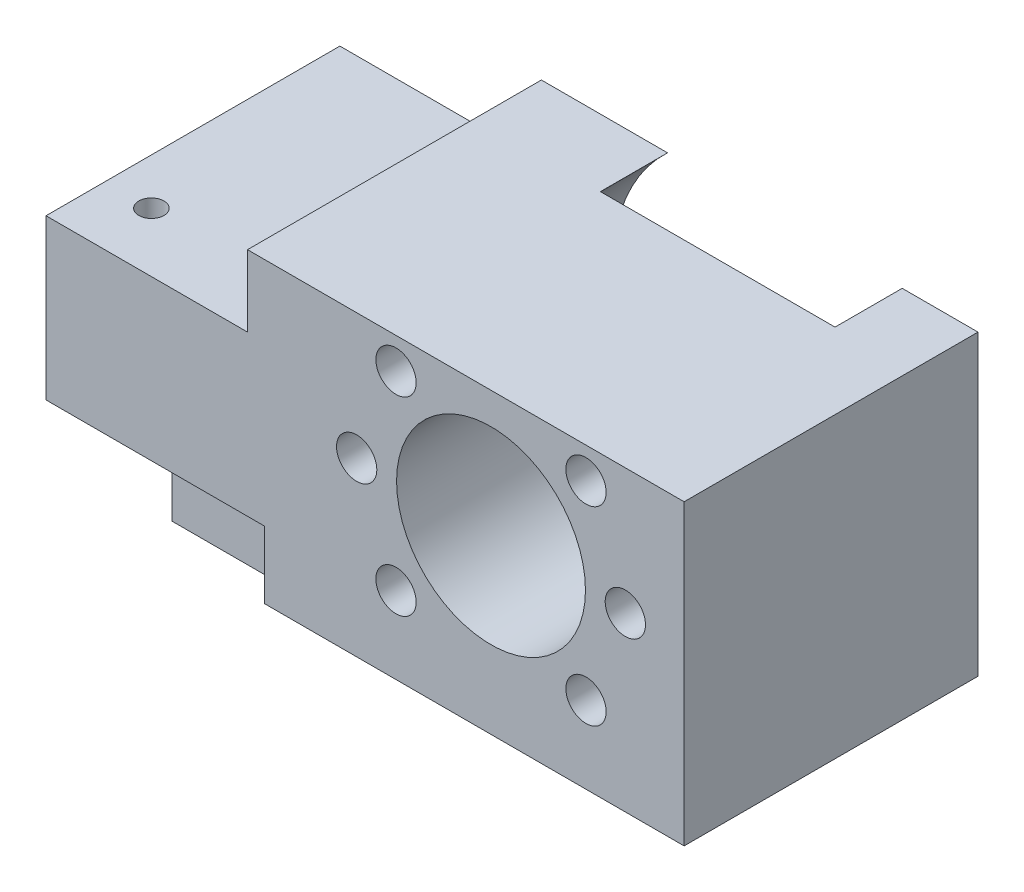
from build123d import *

# Parameters (mm, degrees)
SKETCH_1_W           = 70
SKETCH_1_H           = 30
EXTRUDE_1_DEPTH      = 27
CUT_EXTRUDE_1_DEPTH  = 47.679760068
SKETCH_3_R           = 2.4
CUT_EXTRUDE_2_DEPTH  = 47.679760068
SKETCH_4_W           = 21
SKETCH_4_H           = 8.5
CUT_EXTRUDE_3_DEPTH  = 47.679760068
SKETCH_7_R           = 11.25
CUT_EXTRUDE_5_DEPTH  = 47.679760068
SKETCH_8_W           = 21.5
SKETCH_8_H           = 21.5
EXTRUDE_2_DEPTH      = 8
SKETCH_10_R          = 1.5
CUT_EXTRUDE_6_DEPTH  = 54.422841557
SKETCH_12_W          = 35
SKETCH_12_H          = 21.5
EXTRUDE_3_DEPTH      = 3
SKETCH_13_R          = 3
CUT_EXTRUDE_7_DEPTH  = 15
SKETCH_14_R          = 2.4
EXTRUDE_4_DEPTH      = 27
SKETCH_15_W          = 27
SKETCH_15_H          = 30
EXTRUDE_5_DEPTH      = 3
EXTRUDE_START        = 5.5
SKETCH_16_R          = 3
EXTRUDE_6_DEPTH      = 5.5
SKETCH_22_W          = 26
SKETCH_22_H          = 15
CUT_EXTRUDE_9_DEPTH  = 8
EXTRUDE_START_2      = 8
SKETCH_20_R          = 11.25
EXTRUDE_8_DEPTH      = 8
CUT_EXTRUDE_8_DEPTH  = 8
SKETCH_23_W          = 26
SKETCH_23_H          = 20
EXTRUDE_9_DEPTH      = 17
SKETCH_24_R          = 2
CUT_EXTRUDE_10_DEPTH = 64.837684795
SKETCH_25_R          = 3.75
CUT_EXTRUDE_11_DEPTH = 5
SKETCH_26_R          = 3.1
CUT_EXTRUDE_12_DEPTH = 16
SKETCH_27_R          = 1.25
CUT_EXTRUDE_13_DEPTH = 10
SKETCH_28_W          = 2
SKETCH_28_H          = 12.06571985
CUT_EXTRUDE_14_DEPTH = 16
FILLET_1_R           = 2
SKETCH_29_W          = 20
SKETCH_29_H          = 5
CUT_EXTRUDE_15_DEPTH = 89.945207853


with BuildPart() as part:
    # 草图1 → 凸台-拉伸1 (new body)
    with BuildSketch(Plane.XY):
        Rectangle(SKETCH_1_W, SKETCH_1_H)
    extrude(amount=EXTRUDE_1_DEPTH)

    # 草图2 → 切除-拉伸1 (cut, through all)
    with BuildSketch(Plane.XY.offset(27)):
        with BuildLine():
            Line((28.228756555, -15), (35, -15))
            Line((35, -15), (35, 0))
            ThreePointArc((35, 0), (33.228756555, -8.228756555), (28.228756555, -15))
        make_face()
        with BuildLine():
            ThreePointArc((28.228756555, 15), (33.228756555, 8.228756555), (35, 0))
            Line((35, 0), (35, 15))
            Line((35, 15), (28.228756555, 15))
        make_face()
    extrude(amount=-CUT_EXTRUDE_1_DEPTH, mode=Mode.SUBTRACT)

    # 草图3 → 切除-拉伸2 (cut, through all)
    with BuildSketch(Plane.XY.offset(27)):
        with Locations((31, 0)):
            Circle(SKETCH_3_R)
        with Locations((26.313708499, 11.313708499)):
            Circle(SKETCH_3_R)
        with Locations((26.313708499, -11.313708499)):
            Circle(SKETCH_3_R)
        with Locations((3.686291501, 11.313708499)):
            Circle(SKETCH_3_R)
        with Locations((3.686291501, -11.313708499)):
            Circle(SKETCH_3_R)
        with Locations((-1, 0)):
            Circle(SKETCH_3_R)
    extrude(amount=-CUT_EXTRUDE_2_DEPTH, mode=Mode.SUBTRACT)

    # 草图4 → 切除-拉伸3 (cut, through all)
    with BuildSketch(Plane.XY.offset(27)):
        with Locations((-24.5, 10.75)):
            Rectangle(SKETCH_4_W, SKETCH_4_H)
    extrude(amount=-CUT_EXTRUDE_3_DEPTH, mode=Mode.SUBTRACT)

    # 草图7 → 切除-拉伸5 (cut, through all)
    with BuildSketch(Plane(origin=(0, 0, 0), x_dir=(-1, 0, 0), z_dir=(0, 0, -1))):
        with Locations((-15, 0)):
            Circle(SKETCH_7_R)
    extrude(amount=-CUT_EXTRUDE_5_DEPTH, mode=Mode.SUBTRACT)

    # 草图8 → 凸台-拉伸2 (add)
    with BuildSketch(Plane(origin=(0, 0, 0), x_dir=(-1, 0, 0), z_dir=(0, 0, -1))):
        with Locations((24.25, -4.25)):
            Rectangle(SKETCH_8_W, SKETCH_8_H)
    extrude(amount=EXTRUDE_2_DEPTH)

    # 草图10 → 切除-拉伸6 (cut, through all)
    with BuildSketch(Plane.XZ.offset(15)):
        with Locations((-17.5, 19.95)):
            Circle(SKETCH_10_R)
        with Locations((-32.5, 19.95)):
            Circle(SKETCH_10_R)
    extrude(amount=-CUT_EXTRUDE_6_DEPTH, mode=Mode.SUBTRACT)

    # 草图12 → 凸台-拉伸3 (add)
    with BuildSketch(Plane.ZY.offset(35)):
        with Locations((9.5, -4.25)):
            Rectangle(SKETCH_12_W, SKETCH_12_H)
    extrude(amount=EXTRUDE_3_DEPTH)

    # 草图13 → 切除-拉伸7 (cut)
    with BuildSketch(Plane.XZ.offset(15)):
        with Locations((-32.5, 19.95)):
            Circle(SKETCH_13_R)
        with Locations((-17.5, 19.95)):
            Circle(SKETCH_13_R)
    extrude(amount=-CUT_EXTRUDE_7_DEPTH, mode=Mode.SUBTRACT)

    # 草图14 → 凸台-拉伸4 (add)
    with BuildSketch(Plane.XY.offset(27)):
        with BuildLine():
            Line((28.228756555, -15), (35, -15))
            Line((35, -15), (35, 0))
            Line((35, 0), (35, 15))
            Line((35, 15), (28.228756555, 15))
            Line((28.228756555, 15), (28.228756555, 12.760287547))
            ThreePointArc((28.228756555, 12.760287547), (28.713708499, 11.313708499), (28.228756555, 9.867129451))
            Line((28.228756555, 9.867129451), (28.228756555, 0))
            Line((28.228756555, 0), (28.228756555, -9.867129451))
            ThreePointArc((28.228756555, -9.867129451), (28.713708499, -11.313708499), (28.228756555, -12.760287547))
            Line((28.228756555, -12.760287547), (28.228756555, -15))
        make_face()
        with Locations((31, 0)):
            Circle(SKETCH_14_R, mode=Mode.SUBTRACT)
    extrude(amount=-EXTRUDE_4_DEPTH)

    # 草图15 → 凸台-拉伸5 (add)
    with BuildSketch(Plane(origin=(35, 0, 0), x_dir=(0, 0, -1), z_dir=(1, 0, 0))):
        with Locations((-13.5, 0)):
            Rectangle(SKETCH_15_W, SKETCH_15_H)
    extrude(amount=EXTRUDE_5_DEPTH)

    # 草图16 → 凸台-拉伸6 (add)
    with BuildSketch(Plane.XZ.offset(15).offset(EXTRUDE_START)):
        Polygon((-13.5, 0), (38, 0), (38, 27), (-38, 27), (-38, -8), (-13.5, -8), align=None)
        with Locations((-32.5, 19.95)):
            Circle(SKETCH_16_R, mode=Mode.SUBTRACT)
        with Locations((-17.5, 19.95)):
            Circle(SKETCH_16_R, mode=Mode.SUBTRACT)
    extrude(amount=-EXTRUDE_6_DEPTH)

    # 草图22 → 切除-拉伸9 (cut)
    with BuildSketch(Plane.XZ.offset(20.5)):
        with Locations((-25, 19.5)):
            Rectangle(SKETCH_22_W, SKETCH_22_H)
    extrude(amount=-CUT_EXTRUDE_9_DEPTH, mode=Mode.SUBTRACT)

    # 草图20 → 凸台-拉伸8 (add)
    with BuildSketch(Plane(origin=(0, 0, 0), x_dir=(-1, 0, 0), z_dir=(0, 0, -1)).offset(EXTRUDE_START_2)):
        Polygon((14, 15), (-38, 15), (-38, -20.5), (13.5, -20.5), (13.5, 6.5), (14, 6.5), align=None)
        with Locations((-15, 0)):
            Circle(SKETCH_20_R, mode=Mode.SUBTRACT)
    extrude(amount=-EXTRUDE_8_DEPTH)

    # 草图21 → 切除-拉伸8 (cut)
    with BuildSketch(Plane(origin=(0, 0, -8), x_dir=(-1, 0, 0), z_dir=(0, 0, -1))):
        with BuildLine():
            Line((-27.816005618, -16), (-2.183994382, -16))
            ThreePointArc((-2.183994382, -16), (-15, 20.5), (-27.816005618, -16))
        make_face()
    extrude(amount=-CUT_EXTRUDE_8_DEPTH, mode=Mode.SUBTRACT)

    # 草图23 → 凸台-拉伸9 (add)
    with BuildSketch(Plane.XZ.offset(20.5)):
        with Locations((-25, 2)):
            Rectangle(SKETCH_23_W, SKETCH_23_H)
    extrude(amount=EXTRUDE_9_DEPTH)

    # 草图24 → 切除-拉伸10 (cut, through all)
    with BuildSketch(Plane(origin=(0, 0, -8), x_dir=(-1, 0, 0), z_dir=(0, 0, -1))):
        with Locations((17, -27)):
            Circle(SKETCH_24_R)
        with Locations((25, -27)):
            Circle(SKETCH_24_R)
    extrude(amount=-CUT_EXTRUDE_10_DEPTH, mode=Mode.SUBTRACT)

    # 草图25 → 切除-拉伸11 (cut)
    with BuildSketch(Plane(origin=(0, 0, -8), x_dir=(-1, 0, 0), z_dir=(0, 0, -1))):
        with Locations((17, -27)):
            Circle(SKETCH_25_R)
        with Locations((25, -27)):
            Circle(SKETCH_25_R)
    extrude(amount=-CUT_EXTRUDE_11_DEPTH, mode=Mode.SUBTRACT)

    # 草图26 → 切除-拉伸12 (cut)
    with BuildSketch(Plane.XZ.offset(37.5)):
        with Locations((-31, 7)):
            Circle(SKETCH_26_R)
    extrude(amount=-CUT_EXTRUDE_12_DEPTH, mode=Mode.SUBTRACT)

    # 草图27 → 切除-拉伸13 (cut)
    with BuildSketch(Plane.XZ.offset(21.5)):
        with Locations((-31, 7)):
            Circle(SKETCH_27_R)
    extrude(amount=-CUT_EXTRUDE_13_DEPTH, mode=Mode.SUBTRACT)

    # 草图28 → 切除-拉伸14 (cut)
    with BuildSketch(Plane.XZ.offset(37.5)):
        with Locations((-31, -1.967140075)):
            Rectangle(SKETCH_28_W, SKETCH_28_H)
    extrude(amount=-CUT_EXTRUDE_14_DEPTH, mode=Mode.SUBTRACT)

    # 圆角1
    fillet_1_edges = [part.edges().sort_by_distance(p)[0] for p in [
        (-30, -29.5, 4.06571985),
        (-32, -29.5, 4.06571985),
    ]]
    fillet(fillet_1_edges, radius=FILLET_1_R)

    # 草图29 → 切除-拉伸15 (cut, through all)
    with BuildSketch(Plane.ZY.offset(38)):
        with Locations((2, -35)):
            Rectangle(SKETCH_29_W, SKETCH_29_H)
    extrude(amount=-CUT_EXTRUDE_15_DEPTH, mode=Mode.SUBTRACT)


solid = part.part
